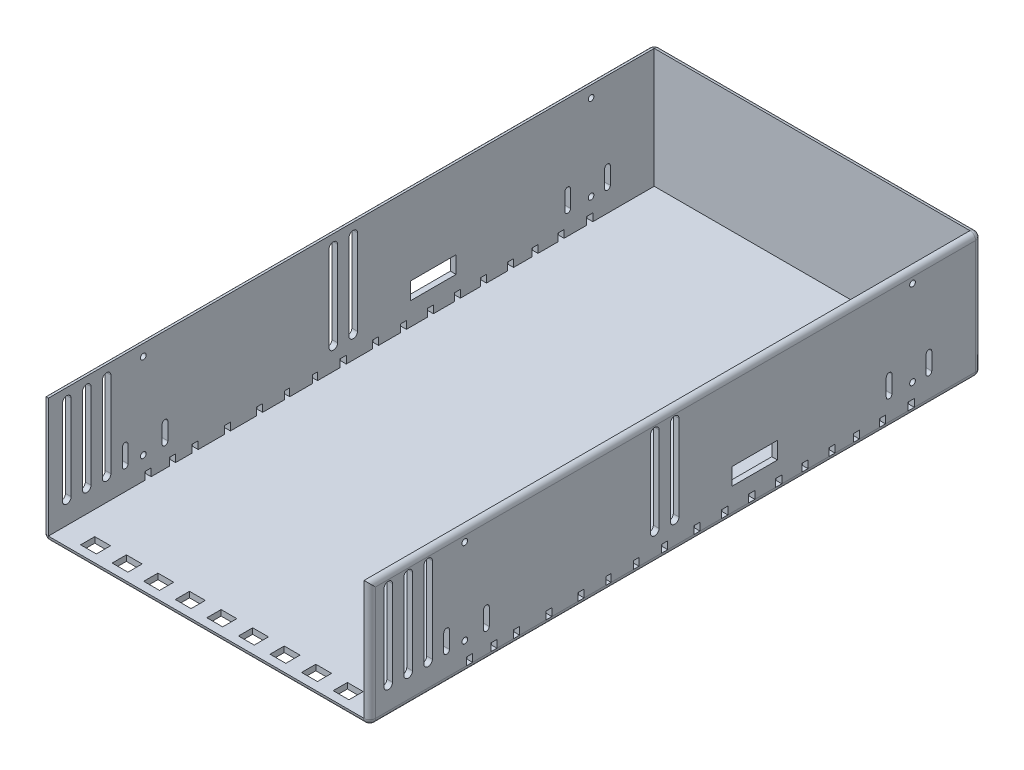
from build123d import *

# Parameters (mm, degrees)
SKETCH1_W               = 115
SKETCH1_H               = 215
BOSS_EXTRUDE1_DEPTH     = 44
CUT_EXTRUDE1_DEPTH      = 248.761982556
CUT_EXTRUDE1_DEPTH_BACK = 42
SKETCH2_W               = 111
SKETCH2_H               = 213
CUT_EXTRUDE2_DEPTH      = 248.761982556
CUT_EXTRUDE2_DEPTH_BACK = 248.761982556
SKETCH3_W               = 16
SKETCH3_H               = 6
SKETCH5_W               = 5.55
SKETCH5_H               = 5
CUT_EXTRUDE3_DEPTH      = 248.414631742
FILLET2_R               = 2
FILLET3_R               = 2
SKETCH6_R               = 1
CUT_EXTRUDE7_DEPTH      = 248.761982556
SKETCH7_W               = 2.143860585
SKETCH7_H               = 2.690556942
SKETCH7_W_2             = 1.837594787
SKETCH7_W_3             = 2.143860584
CUT_EXTRUDE8_DEPTH      = 248.761982556
FILLET6_R               = 2


# Some blends are built 0.0001 mm under size
with BuildPart() as part:
    # Sketch1 → Boss-Extrude1 (new body)
    with BuildSketch(Plane(origin=(0, 0, 0), x_dir=(1, 0, 0), z_dir=(0, 1, 0))):
        with Locations((57.5, 107.5)):
            Rectangle(SKETCH1_W, SKETCH1_H)
    extrude(amount=BOSS_EXTRUDE1_DEPTH)

    # Sketch2 → Cut-Extrude1 (cut, two sides: drawn at the far end of the back side and taken through both)
    with BuildSketch(Plane(origin=(0, 44, 0), x_dir=(1, 0, 0), z_dir=(0, 1, 0)).offset(-CUT_EXTRUDE1_DEPTH_BACK)):
        with Locations((57.5, 106.5)):
            Rectangle(SKETCH2_W, SKETCH2_H)
    extrude(amount=CUT_EXTRUDE1_DEPTH + CUT_EXTRUDE1_DEPTH_BACK, mode=Mode.SUBTRACT)

    # Sketch3 → Cut-Extrude2 (cut, two sides: drawn at the far end of the back side and taken through both)
    with BuildSketch(Plane(origin=(115, 0, 0), x_dir=(0, 0, -1), z_dir=(1, 0, 0)).offset(-CUT_EXTRUDE2_DEPTH_BACK)):
        with Locations((135.324671823, 13)):
            Rectangle(SKETCH3_W, SKETCH3_H)
        with BuildLine():
            Line((5, 40), (5, 10))
            ThreePointArc((5, 10), (6.5, 8.5), (8, 10))
            Line((8, 10), (8, 40))
            ThreePointArc((8, 40), (6.5, 41.5), (5, 40))
        make_face()
        with BuildLine():
            Line((12, 40), (12, 10))
            ThreePointArc((12, 10), (13.5, 8.5), (15, 10))
            Line((15, 10), (15, 40))
            ThreePointArc((15, 40), (13.5, 41.5), (12, 40))
        make_face()
        with BuildLine():
            Line((19, 40), (19, 10))
            ThreePointArc((19, 10), (20.5, 8.5), (22, 10))
            Line((22, 10), (22, 40))
            ThreePointArc((22, 40), (20.5, 41.5), (19, 40))
        make_face()
        with BuildLine():
            Line((26, 10), (26, 16))
            ThreePointArc((26, 16), (27, 17), (28, 16))
            Line((28, 16), (28, 10))
            ThreePointArc((28, 10), (27, 9), (26, 10))
        make_face()
        with BuildLine():
            Line((40, 10), (40, 16))
            ThreePointArc((40, 16), (41, 17), (42, 16))
            Line((42, 16), (42, 10))
            ThreePointArc((42, 10), (41, 9), (40, 10))
        make_face()
        with BuildLine():
            Line((98.689034745, 10), (98.689034745, 40))
            ThreePointArc((98.689034745, 40), (100.189034745, 41.5), (101.689034745, 40))
            Line((101.689034745, 40), (101.689034745, 10))
            ThreePointArc((101.689034745, 10), (100.189034745, 8.5), (98.689034745, 10))
        make_face()
        with BuildLine():
            Line((105.689034745, 10), (105.689034745, 40))
            ThreePointArc((105.689034745, 40), (107.189034745, 41.5), (108.689034745, 40))
            Line((108.689034745, 40), (108.689034745, 10))
            ThreePointArc((108.689034745, 10), (107.189034745, 8.5), (105.689034745, 10))
        make_face()
        with BuildLine():
            Line((197.567176671, 10), (197.567176671, 16))
            ThreePointArc((197.567176671, 16), (196.567176671, 17), (195.567176671, 16))
            Line((195.567176671, 16), (195.567176671, 10))
            ThreePointArc((195.567176671, 10), (196.567176671, 9), (197.567176671, 10))
        make_face()
        with BuildLine():
            Line((183.567176671, 10), (183.567176671, 16))
            ThreePointArc((183.567176671, 16), (182.567176671, 17), (181.567176671, 16))
            Line((181.567176671, 16), (181.567176671, 10))
            ThreePointArc((181.567176671, 10), (182.567176671, 9), (183.567176671, 10))
        make_face()
    extrude(amount=CUT_EXTRUDE2_DEPTH + CUT_EXTRUDE2_DEPTH_BACK, mode=Mode.SUBTRACT)

    # Sketch5 → Cut-Extrude3 (cut, through all)
    with BuildSketch(Plane(origin=(0, 2, 0), x_dir=(1, 0, 0), z_dir=(0, 1, 0))):
        with Locations((13.1, 5.5)):
            Rectangle(SKETCH5_W, SKETCH5_H)
        with Locations((57.5, 5.5)):
            Rectangle(SKETCH5_W, SKETCH5_H)
        with Locations((24.2, 5.5)):
            Rectangle(SKETCH5_W, SKETCH5_H)
        with Locations((35.3, 5.5)):
            Rectangle(SKETCH5_W, SKETCH5_H)
        with Locations((46.4, 5.5)):
            Rectangle(SKETCH5_W, SKETCH5_H)
        with Locations((68.6, 5.5)):
            Rectangle(SKETCH5_W, SKETCH5_H)
        with Locations((79.7, 5.5)):
            Rectangle(SKETCH5_W, SKETCH5_H)
        with Locations((90.8, 5.5)):
            Rectangle(SKETCH5_W, SKETCH5_H)
        with Locations((101.9, 5.5)):
            Rectangle(SKETCH5_W, SKETCH5_H)
    extrude(amount=-CUT_EXTRUDE3_DEPTH, mode=Mode.SUBTRACT)

    # Fillet2
    fillet2_edges = [part.edges().sort_by_distance(p)[0] for p in [
        (57.5, 0, -215),
        (115, 0, -107.5),
        (0, 0, -107.5),
    ]]
    fillet(fillet2_edges, radius=FILLET2_R)

    # Fillet3
    # the kernel refuses this fillet: 2 mm, written as the material it takes off along each edge
    with BuildSketch(Plane(origin=(113, 2, -213), x_dir=(0, 0, -1), z_dir=(1, 0, 0))) as fillet3_piece_1_section:
        Polygon((0, 0), (FILLET3_R, 0), (FILLET3_R, -FILLET3_R), (0, -FILLET3_R), align=None)
    fillet3_piece_1 = extrude(amount=FILLET3_R, mode=Mode.PRIVATE)
    fillet3_piece_1 = fillet3_piece_1 - Plane(origin=(113, 2, -213), x_dir=(0, 0.7071067811865475, 0.7071067811865475), z_dir=(1, 0, 0)) * Sphere(FILLET3_R, mode=Mode.PRIVATE)
    add(fillet3_piece_1, mode=Mode.SUBTRACT)
    with BuildSketch(Plane(origin=(2, 2, -213), x_dir=(0, 0, -1), z_dir=(-1, 0, 0))) as fillet3_piece_2_section:
        Polygon((0, 0), (FILLET3_R, 0), (FILLET3_R, FILLET3_R), (0, FILLET3_R), align=None)
    fillet3_piece_2 = extrude(amount=FILLET3_R, mode=Mode.PRIVATE)
    fillet3_piece_2 = fillet3_piece_2 - Plane(origin=(2, 2, -213), x_dir=(0, 0.7071067811865475, 0.7071067811865475), z_dir=(-1, 0, 0)) * Sphere(FILLET3_R, mode=Mode.PRIVATE)
    add(fillet3_piece_2, mode=Mode.SUBTRACT)
    with BuildSketch(Plane(origin=(0, 2, -215), x_dir=(0, 0, 1), z_dir=(0, 1, 0))) as fillet3_piece_3:
        with BuildLine():
            CenterArc((FILLET3_R, FILLET3_R), FILLET3_R, 180, 90)
            Line((0, FILLET3_R), (0, 0))
            Line((0, 0), (FILLET3_R, 0))
        make_face()
    extrude(amount=47, mode=Mode.SUBTRACT)
    with BuildSketch(Plane(origin=(115, 2, -215), x_dir=(0, 0, 1), z_dir=(0, 1, 0))) as fillet3_piece_4:
        with BuildLine():
            CenterArc((FILLET3_R, -FILLET3_R), FILLET3_R, 90, 90)
            Line((0, -FILLET3_R), (0, 0))
            Line((0, 0), (FILLET3_R, 0))
        make_face()
    extrude(amount=47, mode=Mode.SUBTRACT)

    # Sketch6 → Cut-Extrude7 (cut, through all)
    with BuildSketch(Plane(origin=(115, 0, 0), x_dir=(0, 0, -1), z_dir=(1, 0, 0))):
        with Locations((33.383676924, 9.960658194)):
            Circle(SKETCH6_R)
        with Locations((33.383676924, 39.974706382)):
            Circle(SKETCH6_R)
        with Locations((190.804297011, 9.960658194)):
            Circle(SKETCH6_R)
        with Locations((190.804297011, 39.974706382)):
            Circle(SKETCH6_R)
    extrude(amount=-CUT_EXTRUDE7_DEPTH, mode=Mode.SUBTRACT)

    # Sketch7 → Cut-Extrude8 (cut, through all)
    with BuildSketch(Plane(origin=(115, 0, 0), x_dir=(0, 0, -1), z_dir=(1, 0, 0))):
        with Locations((35.068138812, 3.345278471)):
            Rectangle(SKETCH7_W, SKETCH7_H)
        with Locations((43.643581152, 3.345278471)):
            Rectangle(SKETCH7_W, SKETCH7_H)
        with Locations((62.938326415, 3.345278471)):
            Rectangle(SKETCH7_W, SKETCH7_H)
        with Locations((74.270160935, 3.345278471)):
            Rectangle(SKETCH7_W, SKETCH7_H)
        with Locations((83.917533567, 3.345278471)):
            Rectangle(SKETCH7_W_2, SKETCH7_H)
        with Locations((93.718039098, 3.345278471)):
            Rectangle(SKETCH7_W_2, SKETCH7_H)
        with Locations((115.003512047, 3.345278471)):
            Rectangle(SKETCH7_W_3, SKETCH7_H)
        with Locations((134.29825731, 3.345278471)):
            Rectangle(SKETCH7_W, SKETCH7_H)
        with Locations((143.792497044, 3.345278471)):
            Rectangle(SKETCH7_W, SKETCH7_H)
        with Locations((152.980470979, 3.345278471)):
            Rectangle(SKETCH7_W, SKETCH7_H)
        with Locations((162.474710711, 3.345278471)):
            Rectangle(SKETCH7_W, SKETCH7_H)
        with Locations((171.050153051, 3.345278471)):
            Rectangle(SKETCH7_W_3, SKETCH7_H)
        with Locations((180.238126986, 3.345278471)):
            Rectangle(SKETCH7_W_3, SKETCH7_H)
        with Locations((190.344898315, 3.345278471)):
            Rectangle(SKETCH7_W, SKETCH7_H)
        with Locations((103.671677527, 3.345278471)):
            Rectangle(SKETCH7_W_3, SKETCH7_H)
        with Locations((51.606491895, 3.345278471)):
            Rectangle(SKETCH7_W_3, SKETCH7_H)
        with Locations((124.804017578, 3.345278471)):
            Rectangle(SKETCH7_W, SKETCH7_H)
    extrude(amount=-CUT_EXTRUDE8_DEPTH, mode=Mode.SUBTRACT)

    # Fillet6
    fillet6_edges = [part.edges().sort_by_distance(p)[0] for p in [
        (0.585786438, 44, -214.414213562),
        (114.414213562, 44, -214.414213562),
        (0, 44, -106.5),
        (57.5, 44, -215),
        (115, 44, -106.5),
        (0.585786438, 0.585786438, 0),
        (114.414213562, 0.585786438, 0),
        (57.5, 0, 0),
        (0, 23, 0),
        (115, 23, 0),
    ]]
    fillet(fillet6_edges, radius=FILLET6_R - 0.0001)  # a hair under: the kernel refuses the full size


solid = part.part
